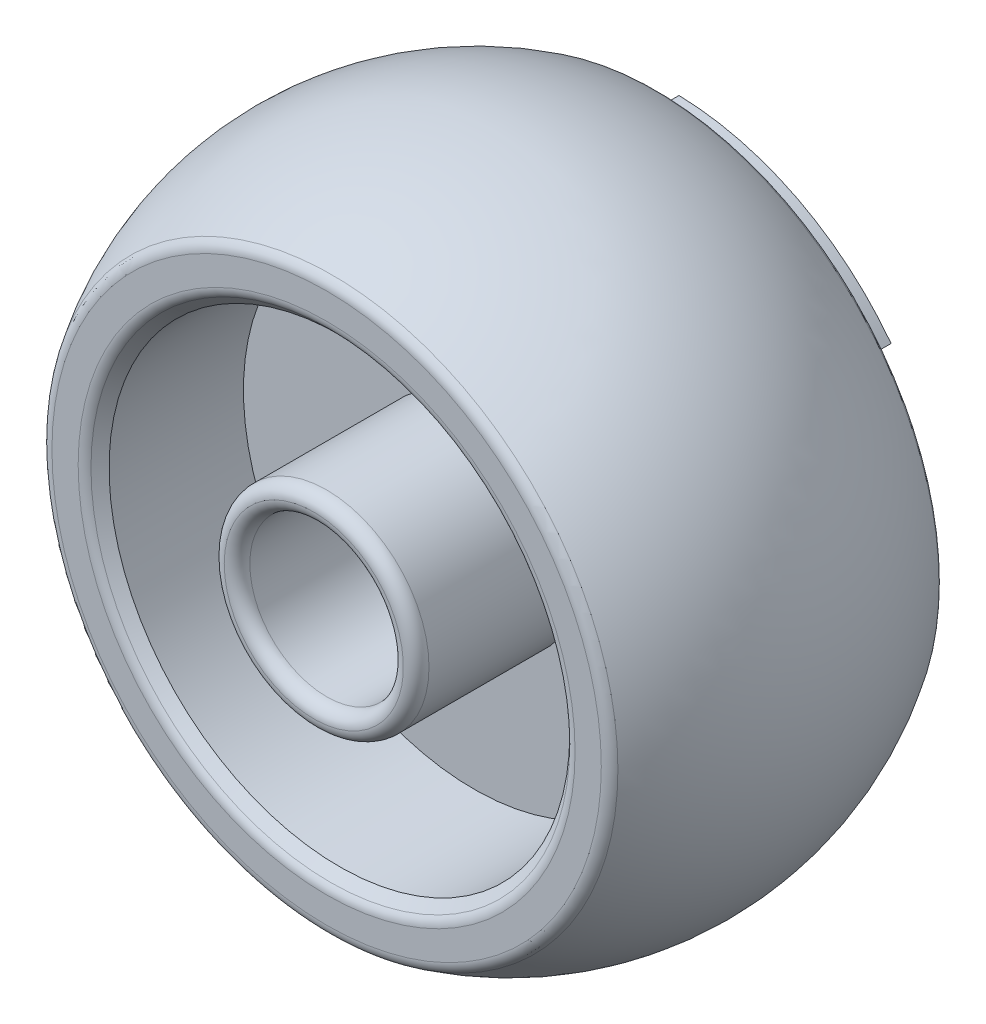
from build123d import *

# Parameters (mm, degrees)
FILLET1_R           = 0.5
FILLET2_R           = 0.5
FILLET3_R           = 0.5
FILLET4_R           = 0.5
SCALE1_SCALE        = 2
BOSS_EXTRUDE1_DEPTH = 1


with BuildPart() as part:
    # Esquisse1 → Révolution1 (revolve)
    with BuildSketch(Plane(origin=(0, 0, 0), x_dir=(0, 0, -1), z_dir=(1, 0, 0)), mode=Mode.PRIVATE) as r_volution1_sk:
        with BuildLine():
            Line((7, 3), (-7, 3))
            Line((-7, 3), (-7, 4))
            Line((-7, 4), (-0.75, 4))
            Line((-0.75, 4), (-0.75, 9))
            Line((-0.75, 9), (-6, 9))
            Line((-6, 9), (-6.5, 9.5))
            Line((-6.5, 9.5), (-6.5, 11))
            ThreePointArc((-6.5, 11), (0, 13), (6.5, 11))
            Line((6.5, 11), (6.5, 9.5))
            Line((6.5, 9.5), (6, 9))
            Line((6, 9), (0.75, 9))
            Line((0.75, 9), (0.75, 4))
            Line((0.75, 4), (7, 4))
            Line((7, 4), (7, 3))
        make_face()
    revolve(r_volution1_sk.sketch.rotate(Axis((0, 0, 4.7147115), (0, 0, -1)), 90), axis=Axis((0, 0, 4.7147115), (0, 0, -1)))

    # Fillet1
    fillet1_edges = [part.edges().sort_by_distance(p)[0] for p in [
        (-4, 0, -7),
        (-3, 0, -7),
    ]]
    fillet(fillet1_edges, radius=FILLET1_R - 0.0001)  # a hair under: the kernel refuses the full size

    # Fillet2
    fillet2_edges = [part.edges().sort_by_distance(p)[0] for p in [
        (-3, 0, 7),
        (-4, 0, 7),
    ]]
    fillet(fillet2_edges, radius=FILLET2_R - 0.0001)  # a hair under: the kernel refuses the full size

    # Fillet3
    fillet3_edges = [part.edges().sort_by_distance(p)[0] for p in [
        (-9.5, 0, 6.5),
        (-11, 0, 6.5),
    ]]
    fillet(fillet3_edges, radius=FILLET3_R)

    # Fillet4
    fillet4_edges = [part.edges().sort_by_distance(p)[0] for p in [
        (-11, 0, -6.5),
        (-9.5, 0, -6.5),
    ]]
    fillet(fillet4_edges, radius=FILLET4_R)


with BuildPart() as part_1:
    # Scale1: scaled about (-3.9e-08, 0, 1.45e-07)
    add(part.part.scale(SCALE1_SCALE).moved(Location((3.9e-08, 0, -1.45e-07))))

    # Sketch1 → Boss-Extrude1 (add)
    with BuildSketch(Plane(origin=(0, 0, -13), x_dir=(-1, 0, 0), z_dir=(0, 0, -1))):
        with BuildLine():
            Line((-15.475500088, 11.722652655), (-17.108673516, 12.959777446))
            ThreePointArc((-17.108673516, 12.959777446), (-9.791345513, 19.09953125), (-0.534721447, 21.45638865))
            Line((-0.534721447, 21.45638865), (-0.48367758, 19.408187557))
            ThreePointArc((-0.48367758, 19.408187557), (-8.856675429, 17.276312934), (-15.475500088, 11.722652655))
        make_face()
        with BuildLine():
            Line((17.889865043, 7.540849885), (19.777833254, 8.336657167))
            ThreePointArc((19.777833254, 8.336657167), (21.43635202, -1.070211674), (18.849138368, -10.265111968))
            Line((18.849138368, -10.265111968), (17.049822256, -9.285216707))
            ThreePointArc((17.049822256, -9.285216707), (19.390063599, -0.968050553), (17.889865043, 7.540849885))
        make_face()
        with BuildLine():
            Line((-2.414364955, -19.26350254), (-2.669159738, -21.296434613))
            ThreePointArc((-2.669159738, -21.296434613), (-11.645006507, -18.029319576), (-18.314416921, -11.191276683))
            Line((-18.314416921, -11.191276683), (-16.566144676, -10.12297085))
            ThreePointArc((-16.566144676, -10.12297085), (-10.53338817, -16.308262381), (-2.414364955, -19.26350254))
        make_face()
    extrude(amount=BOSS_EXTRUDE1_DEPTH)


solid = part_1.part
